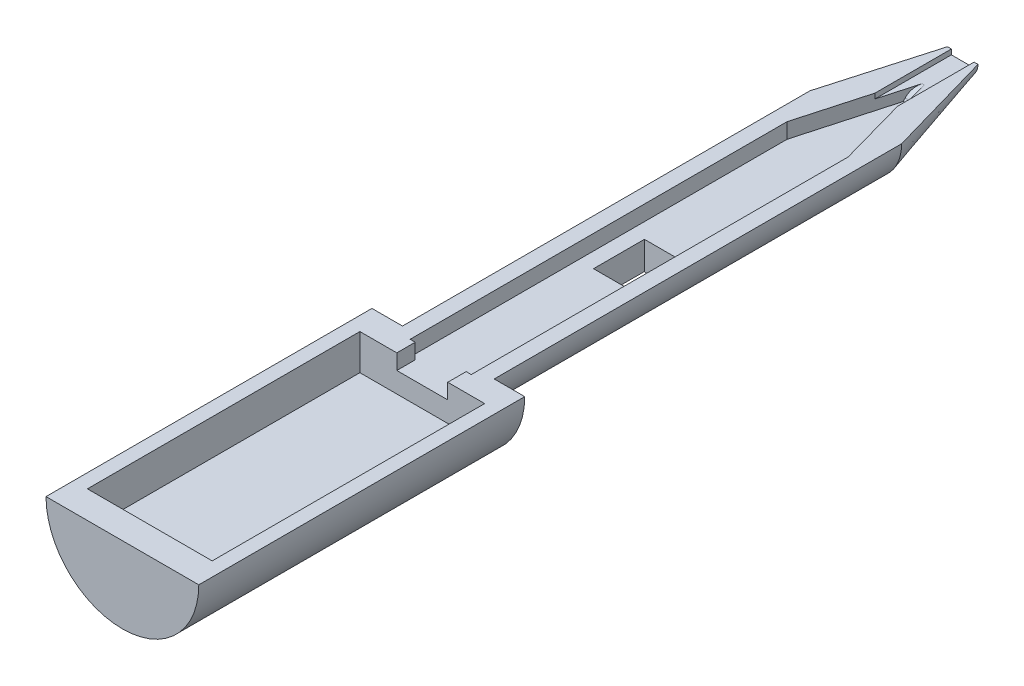
from build123d import *

# Parameters (mm, degrees)
REVOLVE1_ANGLE          = 180
SKETCH3_W               = 24.5
SKETCH3_H               = 53.5
CUT_EXTRUDE1_DEPTH      = 7
CUT_EXTRUDE2_DEPTH      = 3
SKETCH5_W               = 2.5
SKETCH5_H               = 3.617532458
CUT_EXTRUDE3_DEPTH      = 3
CUT_EXTRUDE4_REACH      = 168.114
CUT_EXTRUDE4_END_RADIUS = 9
SKETCH6_W               = 6
SKETCH6_H               = 10
SKETCH7_W               = 4.455882352
SKETCH7_H               = 15
CUT_EXTRUDE5_DEPTH      = 1
SKETCH8_W               = 5
SKETCH8_H               = 3.617532458
CUT_EXTRUDE6_DEPTH      = 3
CHAMFER10_SIZE          = 2
CHAMFER10_SIZE_2        = 3.464101615
FILLET1_R               = 3


with BuildPart() as part:
    # Sketch2 → Revolve1 (revolve)
    with BuildSketch(Plane(origin=(0, 0, 0), x_dir=(1, 0, 0), z_dir=(0, 1, 0))):
        Polygon((0, 0), (-15, 0), (-15, 64), (-9, 64), (-9, 144), (-3, 165), (0, 165), align=None)
    revolve(axis=Axis((0, 0, -165), (0, 0, 1)), revolution_arc=REVOLVE1_ANGLE)

    # Sketch3 → Cut-Extrude1 (cut)
    with BuildSketch(Plane(origin=(0, 0, 0), x_dir=(1, 0, 0), z_dir=(0, 1, 0))):
        with Locations((0, 32.132467542)):
            Rectangle(SKETCH3_W, SKETCH3_H)
    extrude(amount=-CUT_EXTRUDE1_DEPTH, mode=Mode.SUBTRACT)

    # Sketch4 → Cut-Extrude2 (cut)
    with BuildSketch(Plane(origin=(0, 0, 0), x_dir=(1, 0, 0), z_dir=(0, 1, 0))):
        Polygon((-6, 62.5), (6, 62.5), (6, 136.5), (1.25, 153.5), (-1.25, 153.5), (-6, 136.5), align=None)
    extrude(amount=-CUT_EXTRUDE2_DEPTH, mode=Mode.SUBTRACT)

    # Sketch5 → Cut-Extrude3 (cut)
    with BuildSketch(Plane(origin=(0, 0, 0), x_dir=(1, 0, 0), z_dir=(0, 1, 0))):
        with Locations((-3.75, 60.691233771)):
            Rectangle(SKETCH5_W, SKETCH5_H)
        with Locations((3.75, 60.691233771)):
            Rectangle(SKETCH5_W, SKETCH5_H)
    extrude(amount=-CUT_EXTRUDE3_DEPTH, mode=Mode.SUBTRACT)

    # Cut-Extrude4: up to this cylinder (the profile starts inside it)
    cut_extrude4_end = Plane(origin=(0, 0, -100.5), z_dir=(0, 0, -1)) * Cylinder(CUT_EXTRUDE4_END_RADIUS, 355.228, mode=Mode.PRIVATE)
    # Sketch6 → Cut-Extrude4 (cut, up to the surface)
    with BuildSketch(Plane(origin=(0, -3, 0), x_dir=(1, 0, 0), z_dir=(0, 1, 0)), mode=Mode.PRIVATE) as cut_extrude4_sk1:
        with Locations((0, 100.5)):
            Rectangle(SKETCH6_W, SKETCH6_H)
    cut_extrude4_tool1 = extrude(cut_extrude4_sk1.sketch, amount=-CUT_EXTRUDE4_REACH, mode=Mode.PRIVATE) & cut_extrude4_end
    add(cut_extrude4_tool1.solids().sort_by_distance((0, -3, -100.5))[0], mode=Mode.SUBTRACT)

    # Sketch7 → Cut-Extrude5 (cut)
    with BuildSketch(Plane(origin=(0, 0, 0), x_dir=(1, 0, 0), z_dir=(0, 1, 0))):
        with Locations((0, 157.5)):
            Rectangle(SKETCH7_W, SKETCH7_H)
    extrude(amount=-CUT_EXTRUDE5_DEPTH, mode=Mode.SUBTRACT)

    # Sketch8 → Cut-Extrude6 (cut)
    with BuildSketch(Plane(origin=(0, 0, 0), x_dir=(1, 0, 0), z_dir=(0, 1, 0))):
        with Locations((0, 60.691233771)):
            Rectangle(SKETCH8_W, SKETCH8_H)
    extrude(amount=-CUT_EXTRUDE6_DEPTH, mode=Mode.SUBTRACT)

    # Chamfer10
    # the kernel refuses this chamfer: 3.464101615, 2 mm, written as the material it takes off along each edge
    with BuildSketch(Plane(origin=(10.211927941, -1, -153.5), x_dir=(0, 0.05789386240267106, -0.9983227437537926), z_dir=(-1, 0, 0))) as chamfer10_piece_1_section:
        Polygon((CHAMFER10_SIZE * 0.998322743754, CHAMFER10_SIZE * 0.0578938624027), (-CHAMFER10_SIZE_2 * 0.057893862405, CHAMFER10_SIZE_2 * 0.998322743793), (0, 0), align=None)
    chamfer10_piece_1 = extrude(amount=20.423855882, mode=Mode.PRIVATE)
    chamfer10_piece_1 = split(chamfer10_piece_1, bisect_by=Plane(origin=(0, -3, -154.190565485), z_dir=(0, 1, 0)), keep=Keep.TOP, mode=Mode.PRIVATE)
    chamfer10_piece_1 = split(chamfer10_piece_1, bisect_by=Plane(origin=(-0.980499377, -1.889149357, -154.464528546), z_dir=(0.9631109740028581, 6.725367985932025e-15, 0.26910453685374025)), keep=Keep.TOP, mode=Mode.PRIVATE)
    chamfer10_piece_1 = split(chamfer10_piece_1, bisect_by=Plane(origin=(0.980499377, -1.889149357, -154.464528546), z_dir=(-0.9631109740028581, -6.725367985932025e-15, 0.26910453685374025)), keep=Keep.TOP, mode=Mode.PRIVATE)
    add(chamfer10_piece_1, mode=Mode.SUBTRACT)

    # Fillet1
    fillet1_edges = [part.edges().sort_by_distance(p)[0] for p in [
        (0, -1, -155.5),
    ]]
    fillet(fillet1_edges, radius=FILLET1_R)


solid = part.part
